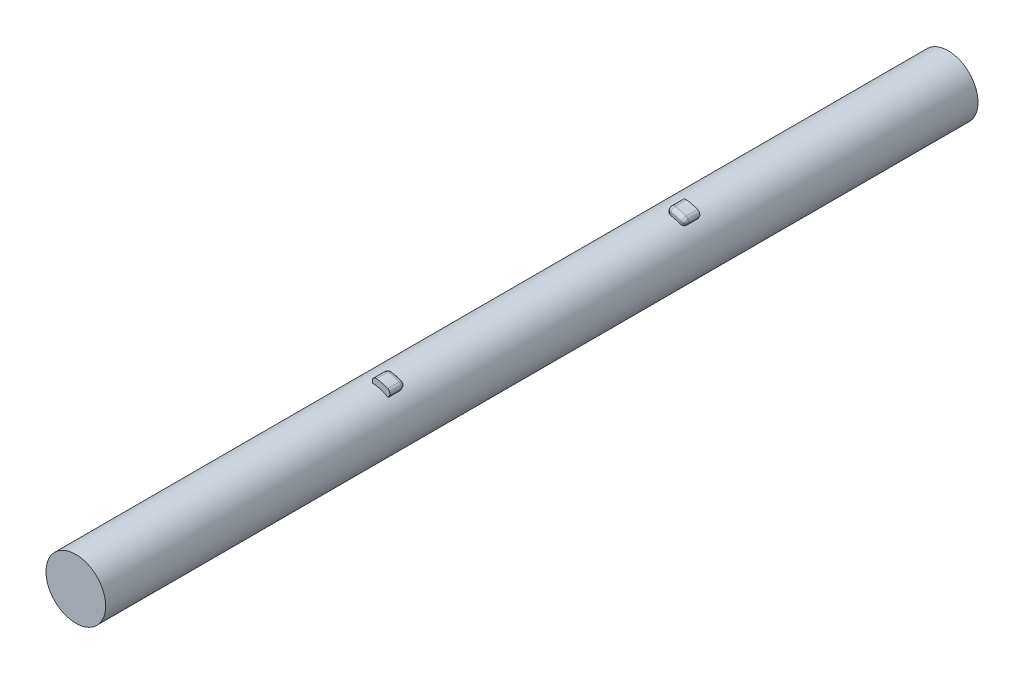
from build123d import *

# Parameters (mm, degrees)
SZKIC1_R                    = 3.9
DODANIE_WYCI_GNI_CIE1_DEPTH = 114
SZKIC4_W                    = 2
SZKIC4_H                    = 5
OBR_T1_ANGLE                = 30
ZAOKR_GLENIE5_R             = 0.5


with BuildPart() as part:
    # Szkic1 → Dodanie-wyciągnięcie1 (new body)
    with BuildSketch(Plane.XY):
        Circle(SZKIC1_R)
    extrude(amount=DODANIE_WYCI_GNI_CIE1_DEPTH)

    # Szkic4 → Obrót1 (revolve)
    with BuildSketch(Plane(origin=(0, 0, 0), x_dir=(0, 0, -1), z_dir=(1, 0, 0))):
        with Locations((-74.25, 2.217381868)):
            Rectangle(SZKIC4_W, SZKIC4_H)
        with Locations((-35.75, 2.217381868)):
            Rectangle(SZKIC4_W, SZKIC4_H)
    revolve(axis=Axis((0, -0.282618132, 75.25), (0, 0, -1)), revolution_arc=OBR_T1_ANGLE)

    # Zaokrąglenie5
    zaokr_glenie5_edges = [part.edges().sort_by_distance(p)[0] for p in [
        (0, 4.717381868, 74.25),
        (2.5, 4.047508887, 74.25),
        (0, 4.308690934, 73.25),
        (2.285548402, 3.676067824, 73.25),
        (1.294095226, 4.547010999, 73.25),
        (0, 4.308690934, 36.75),
        (2.285548402, 3.676067824, 36.75),
        (1.294095226, 4.547010999, 36.75),
        (2.5, 4.047508887, 35.75),
        (0, 4.717381868, 35.75),
    ]]
    fillet(zaokr_glenie5_edges, radius=ZAOKR_GLENIE5_R)


solid = part.part
